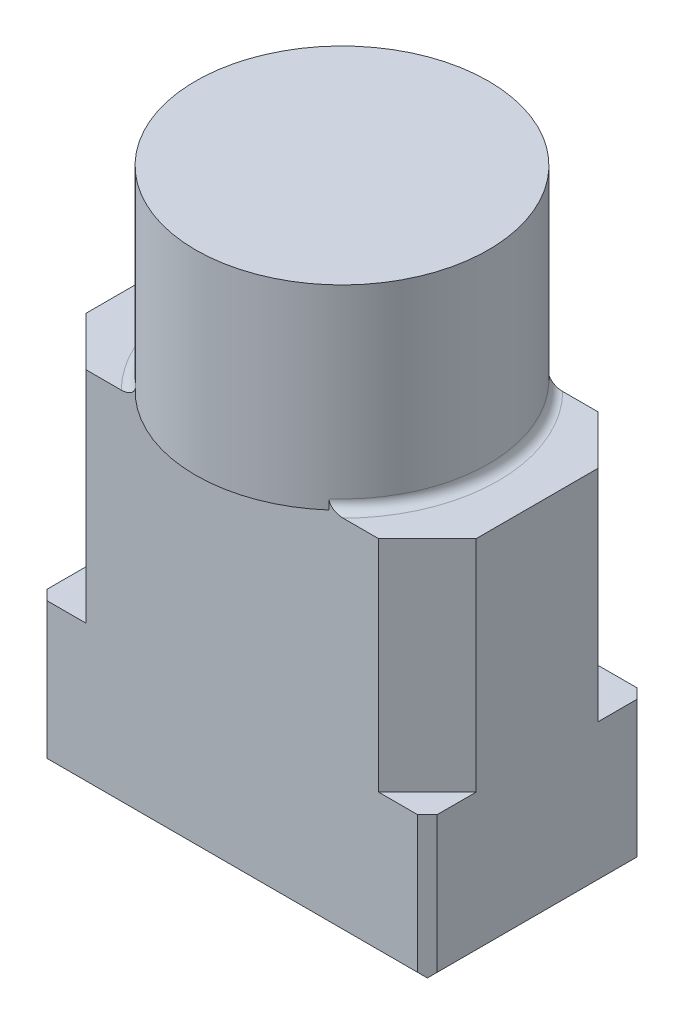
from build123d import *

# Parameters (mm, degrees)
SKETCH1_R           = 30
BOSS_EXTRUDE1_DEPTH = 40
SKETCH2_W           = 80
SKETCH2_H           = 45
BOSS_EXTRUDE2_DEPTH = 45
CHAMFER1_SIZE       = 10
SKETCH4_W           = 80
SKETCH4_H           = 45
BOSS_EXTRUDE3_DEPTH = 2
SKETCH5_W           = 80
SKETCH5_H           = 45
BOSS_EXTRUDE4_DEPTH = 30
CHAMFER2_SIZE       = 2
CHAMFER3_SIZE       = 4
FILLET1_R           = 2


with BuildPart() as part:
    # Sketch1 → Boss-Extrude1 (new body)
    with BuildSketch(Plane(origin=(0, 0, 0), x_dir=(1, 0, 0), z_dir=(0, 1, 0))):
        with Locations(Location((0, 0, 0), (0, 0, 270))):
            Circle(SKETCH1_R)
    extrude(amount=BOSS_EXTRUDE1_DEPTH)

    # Sketch2 → Boss-Extrude2 (add)
    with BuildSketch(Plane.XZ):
        Rectangle(SKETCH2_W, SKETCH2_H)
    extrude(amount=BOSS_EXTRUDE2_DEPTH)

    # Chamfer1
    chamfer1_edges = [part.edges().sort_by_distance(p)[0] for p in [
        (40, -22.5, 22.5),
        (-40, -22.5, 22.5),
        (-40, -22.5, -22.5),
        (40, -22.5, -22.5),
    ]]
    chamfer(chamfer1_edges, length=CHAMFER1_SIZE)

    # Sketch4 → Boss-Extrude3 (add)
    with BuildSketch(Plane(origin=(0, -45, 0), x_dir=(-1, 0, 0), z_dir=(0, -1, 0))):
        Rectangle(SKETCH4_W, SKETCH4_H)
    extrude(amount=BOSS_EXTRUDE3_DEPTH)

    # Sketch5 → Boss-Extrude4 (add)
    with BuildSketch(Plane.XZ.offset(47)):
        Rectangle(SKETCH5_W, SKETCH5_H)
    extrude(amount=BOSS_EXTRUDE4_DEPTH)

    # Chamfer2
    chamfer2_edges = [part.edges().sort_by_distance(p)[0] for p in [
        (40, -61, -22.5),
        (40, -61, 22.5),
        (-40, -61, 22.5),
        (-40, -61, -22.5),
    ]]
    chamfer(chamfer2_edges, length=CHAMFER2_SIZE)

    # Chamfer3
    # the kernel refuses this chamfer: 4 mm, written as the material it takes off along each edge
    with BuildSketch(Plane(origin=(48.286731952, -77, 22.5), x_dir=(0, 0.9996219169112968, 0.02749587661058651), z_dir=(-1, 0, 0))) as chamfer3_piece_1:
        Polygon((CHAMFER3_SIZE * 0.999621916911, CHAMFER3_SIZE * 0.0274958766106), (-CHAMFER3_SIZE * 0.0274958766106, CHAMFER3_SIZE * 0.999621916911), (0, 0), align=None)
    extrude(amount=96.573463904, mode=Mode.SUBTRACT)
    with BuildSketch(Plane(origin=(-40, -77, 30.786731952), x_dir=(0.9996219169112968, -0.027495876610585647, 0), z_dir=(0, 0, -1)), Plane(origin=(40, -77, -30.786731952), x_dir=(-0.9996219169112968, -0.027495876610585647, 0), z_dir=(0, 0, 1))) as chamfer3_piece_2:
        Polygon((CHAMFER3_SIZE * 0.999621916911, -CHAMFER3_SIZE * 0.0274958766106), (-CHAMFER3_SIZE * 0.0274958766106, -CHAMFER3_SIZE * 0.999621916911), (0, 0), align=None)
    extrude(amount=61.573463904, mode=Mode.SUBTRACT)
    with BuildSketch(Plane(origin=(-48.286731952, -77, -22.5), x_dir=(0, -0.027495876610585623, 0.9996219169112968), z_dir=(1, 0, 0))) as chamfer3_piece_3:
        Polygon((CHAMFER3_SIZE * 0.999621916911, -CHAMFER3_SIZE * 0.0274958766106), (-CHAMFER3_SIZE * 0.0274958766106, -CHAMFER3_SIZE * 0.999621916911), (0, 0), align=None)
    extrude(amount=96.573463904, mode=Mode.SUBTRACT)

    # Fillet1
    # the kernel refuses this fillet: 2 mm, written as the material it adds along each edge
    with BuildSketch(Plane(origin=(0, 0, 0), x_dir=(0.527784032478236, 0, 0.8493786052526943), z_dir=(-0.8493786052526943, 0, 0.527784032478236))) as fillet1_piece_1_section:
        with BuildLine():
            CenterArc((30 + FILLET1_R, FILLET1_R), FILLET1_R, 180, 90)
            Line((30, FILLET1_R), (30, 0))
            Line((30, 0), (30 + FILLET1_R, 0))
        make_face()
    fillet1_piece_1 = revolve(axis=Axis((0, 0, 0), (0, 1, 0)), revolution_arc=116.288294518, mode=Mode.PRIVATE)
    fillet1_piece_1 = split(fillet1_piece_1, bisect_by=Plane(origin=(30.560923214, 0.560923214, 22.5), z_dir=(0, 0, -1)), keep=Keep.TOP, mode=Mode.PRIVATE)
    fillet1_piece_1 = split(fillet1_piece_1, bisect_by=Plane(origin=(30.560923214, 0.560923214, -22.5), z_dir=(0, 0, 1)), keep=Keep.TOP, mode=Mode.PRIVATE)
    add(fillet1_piece_1)
    with BuildSketch(Plane(origin=(0, 0, 0), x_dir=(-0.527784032478229, 0, -0.8493786052526988), z_dir=(0.8493786052526988, 0, -0.527784032478229))) as fillet1_piece_2_section:
        with BuildLine():
            CenterArc((30 + FILLET1_R, FILLET1_R), FILLET1_R, 180, 90)
            Line((30, FILLET1_R), (30, 0))
            Line((30, 0), (30 + FILLET1_R, 0))
        make_face()
    fillet1_piece_2 = revolve(axis=Axis((0, 0, 0), (0, 1, 0)), revolution_arc=116.288294518, mode=Mode.PRIVATE)
    fillet1_piece_2 = split(fillet1_piece_2, bisect_by=Plane(origin=(-30.560923214, 0.560923214, 22.5), z_dir=(0, 0, -1)), keep=Keep.TOP, mode=Mode.PRIVATE)
    fillet1_piece_2 = split(fillet1_piece_2, bisect_by=Plane(origin=(-30.560923214, 0.560923214, -22.5), z_dir=(0, 0, 1)), keep=Keep.TOP, mode=Mode.PRIVATE)
    add(fillet1_piece_2)


solid = part.part
